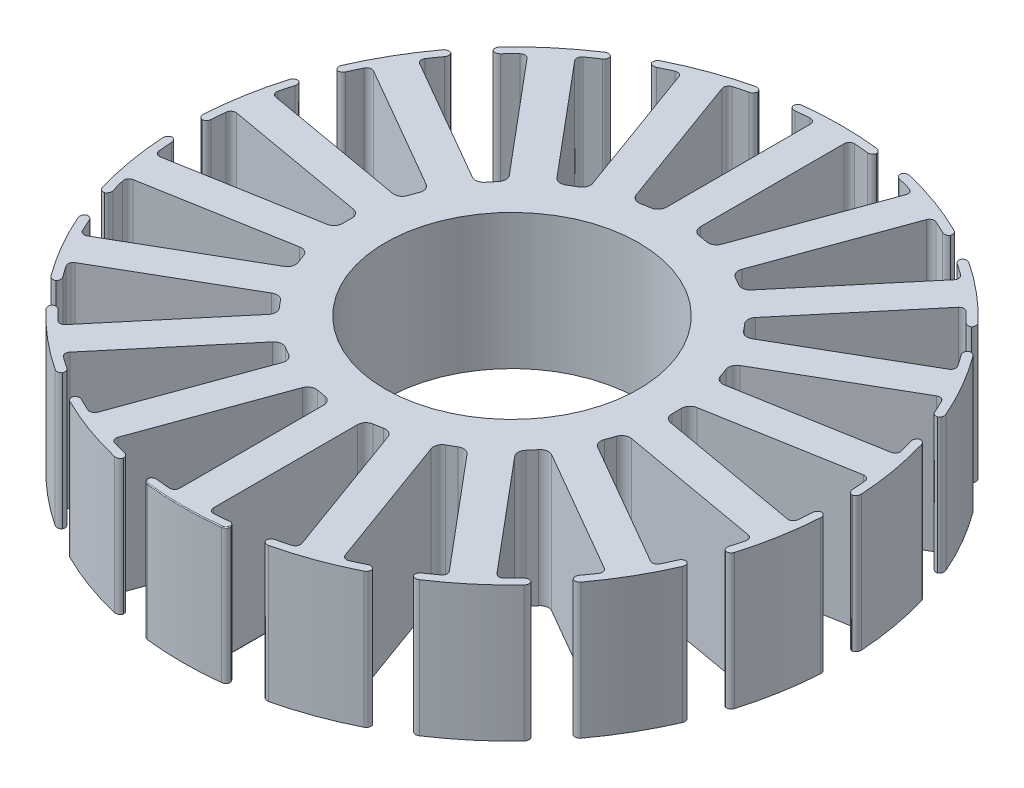
from build123d import *

# Parameters (mm, degrees)
SKETCH1_R           = 9.75
BOSS_EXTRUDE1_DEPTH = 4
BOSS_EXTRUDE2_DEPTH = 8
FILLET1_R           = 0.3
CIRPATTERN1_START   = -4
CIRPATTERN1_DEPTH   = 8
FILLET2_R           = 0.5
SKETCH3_R           = 7.5
CUT_EXTRUDE1_DEPTH  = 29.68939020627841
FILLET3_R           = 0.05


# Read off the part's stored shape, not the designer's step: CirPattern1
with BuildPart() as part:
    # Sketch1 → Boss-Extrude1 (new, symmetric)
    with BuildSketch(Plane(origin=(0, 0, 0), x_dir=(1, 0, 0), z_dir=(0, 1, 0))):
        with Locations(Location((0, 0, 0), (0, 0, 270))):
            Circle(SKETCH1_R)
    extrude(amount=BOSS_EXTRUDE1_DEPTH, both=True)

    # Sketch2 → Boss-Extrude2 (add)
    with BuildSketch(Plane(origin=(0, 4, 0), x_dir=(1, 0, 0), z_dir=(0, 1, 0))):
        with BuildLine():
            Line((-2.5, 19.339079605813716), (-2.4358974358974352, 18.84320576976721))
            ThreePointArc((-2.4358974358974352, 18.84320576976721), (-1.719186657369247, 18.92206112549908), (-1.0000000000000002, 18.973665961010276))
            Line((-1.0000000000000002, 18.973665961010276), (-1.0000000000000016, 9.69858237063541))
            ThreePointArc((-1.0000000000000016, 9.69858237063541), (6e-16, 9.749999999999998), (1.0000000000000016, 9.69858237063541))
            Line((1.0000000000000016, 9.69858237063541), (1.0000000000000002, 18.973665961010276))
            ThreePointArc((1.0000000000000002, 18.973665961010276), (1.719186657369245, 18.92206112549908), (2.4358974358974352, 18.84320576976721))
            Line((2.4358974358974352, 18.84320576976721), (2.5, 19.339079605813716))
            ThreePointArc((2.5, 19.339079605813716), (1.19e-15, 19.5), (-2.5, 19.339079605813716))
        make_face()
    extrude(amount=-BOSS_EXTRUDE2_DEPTH)

    # Fillet1
    # the kernel refuses this fillet: 0.3 mm, written as the material it adds along each edge
    with BuildSketch(Plane(origin=(-1.0000000000000004, 4, -18.973665961010276), x_dir=(7e-16, 0, 1), z_dir=(0, -1, 0))) as fillet1_piece_1:
        with BuildLine():
            CenterArc((0.3189078548326447, 0.30000000000000004), FILLET1_R, 176.01365563324396, 93.9863443667561)
            ThreePointArc((0.01963366061589134, 0.320855614973262), (0.00913825970817672, 0.16046933029077692), (0, 0))
            Line((0, 0), (0.31890785483264494, 0))
        make_face()
    extrude(amount=8)
    with BuildSketch(Plane(origin=(1.0000000000000002, 4, -18.973665961010276), x_dir=(0, 0, 1), z_dir=(0, -1, 0))) as fillet1_piece_2:
        with BuildLine():
            CenterArc((0.3189078548326485, -0.30000000000000004), FILLET1_R, 90, 93.98634436675627)
            ThreePointArc((0.01963366061589511, -0.3208556149732631), (0.00913825970818749, -0.16046933029077737), (0, 0))
            Line((0, 0), (0.3189078548326485, 0))
        make_face()
    extrude(amount=8)
    # the kernel refuses this fillet: 0.3 mm, written as the material it takes off along each edge
    with BuildSketch(Plane(origin=(2.5, 4.7617419982947435, -19.339079605813716), x_dir=(-0.12820512820513022, 0, 0.9917476720930107), z_dir=(0, -1, 0))) as fillet1_2_piece_1:
        with BuildLine():
            CenterArc((0.3023438930686183, 0.3000000000000001), FILLET1_R, 179.10471701342968, 90.89528298657052)
            ThreePointArc((0.00238051639781486, 0.3046875000000011), (0.00059513818123078, 0.15234839965894825), (0, 0))
            Line((0, 0), (0.30234389306861936, -1e-17))
        make_face()
    extrude(amount=9.523483996589487, mode=Mode.SUBTRACT)
    with BuildSketch(Plane(origin=(2.4358974358974352, 4.744170632315791, -18.84320576976721), x_dir=(-0.9927141599266197, 0, -0.12049313956066374), z_dir=(0, -1, 0))) as fillet1_2_piece_2:
        with BuildLine():
            CenterArc((0.29767738495924506, 0.2999909386698613), FILLET1_R, 180.44532191998718, 89.10935616002467)
            Line((-0.00231355371061729, 0.2976592620252788), (0, 0))
            ThreePointArc((0, 0), (0.14767285415732825, 0.00057388424205642), (0.29534570831465756, 0))
        make_face()
    extrude(amount=9.488341264631583, mode=Mode.SUBTRACT)
    with BuildSketch(Plane(origin=(-2.4999999999999996, 4.761741998294736, -19.339079605813712), x_dir=(0.992719037180409, 0, -0.1204529502320369), z_dir=(0, -1, 0))) as fillet1_2_piece_3:
        with BuildLine():
            CenterArc((0.3023529777846742, 0.29999084402798165), FILLET1_R, 179.55235850671582, 90.89528298657035)
            Line((0.00236213375669306, 0.30233466556119165), (0, 0))
            ThreePointArc((0, 0), (0.152348399658946, -0.00059513818123317), (0.30469679931789456, 0))
        make_face()
    extrude(amount=9.523483996589473, mode=Mode.SUBTRACT)
    with BuildSketch(Plane(origin=(-2.4358974358974357, 4.7441706323157815, -18.843205769767213), x_dir=(-0.1282051282051297, 0, -0.9917476720930108), z_dir=(0, -1, 0))) as fillet1_2_piece_4:
        with BuildLine():
            CenterArc((0.29766825292631033, 0.3000000000000001), FILLET1_R, 180.89064383997697, 89.1093561600228)
            ThreePointArc((-0.00229550230052261, 0.2953367875647671), (-0.00057388424205535, 0.14767285415733003), (0, 0))
            Line((0, 0), (0.29766825292630916, 0))
        make_face()
    extrude(amount=9.488341264631565, mode=Mode.SUBTRACT)

    # CirPattern1 outline → CirPattern1 (add)
    with BuildSketch(Plane(origin=(0, 0, 0), x_dir=(1, 0, 0), z_dir=(0, 1, 0)).offset(CIRPATTERN1_START)):
        with BuildLine():
            ThreePointArc((8.843866585, 17.095570796), (8.834578433, 17.303770723), (8.691902388, 17.455681965))
            ThreePointArc((8.691902388, 17.455681965), (6.669392795, 18.324006105), (4.561912562, 18.95887533))
            ThreePointArc((4.561912562, 18.95887533), (4.354969706, 18.934214961), (4.214026235, 18.780694873))
            ThreePointArc((4.214026235, 18.780694873), (4.273128601, 18.585426965), (4.443444721, 18.473110161))
            ThreePointArc((4.443444721, 18.473110161), (4.843596075, 18.37225019), (5.241462569, 18.262723514))
            ThreePointArc((5.241462569, 18.262723514), (5.42602082, 18.110530017), (5.44061042, 17.871758678))
            Line((5.44061042, 17.871758678), (2.377417912, 9.455706429))
            ThreePointArc((2.377417912, 9.455706429), (3.334696398, 9.162003053), (4.256803153, 8.771666143))
            Line((4.256803153, 8.771666143), (7.319995662, 17.187718392))
            ThreePointArc((7.319995662, 17.187718392), (7.484651202, 17.361249834), (7.723859118, 17.35920506))
            ThreePointArc((7.723859118, 17.35920506), (8.099044926, 17.18736371), (8.470410186, 17.007414597))
            ThreePointArc((8.470410186, 17.007414597), (8.673075754, 16.983977169), (8.843866585, 17.095570796))
        make_face()
        with BuildLine():
            Line((-7.319995662, 17.187718392), (-4.256803153, 8.771666143))
            ThreePointArc((-4.256803153, 8.771666143), (-3.334696398, 9.162003053), (-2.377417912, 9.455706429))
            Line((-2.377417912, 9.455706429), (-5.44061042, 17.871758678))
            ThreePointArc((-5.44061042, 17.871758678), (-5.42602082, 18.110530017), (-5.241462569, 18.262723514))
            ThreePointArc((-5.241462569, 18.262723514), (-4.843596075, 18.37225019), (-4.443444721, 18.473110161))
            ThreePointArc((-4.443444721, 18.473110161), (-4.273128601, 18.585426965), (-4.214026235, 18.780694873))
            ThreePointArc((-4.214026235, 18.780694873), (-4.354969706, 18.934214961), (-4.561912562, 18.95887533))
            ThreePointArc((-4.561912562, 18.95887533), (-6.669392795, 18.324006105), (-8.691902388, 17.455681965))
            ThreePointArc((-8.691902388, 17.455681965), (-8.834578433, 17.303770723), (-8.843866585, 17.095570796))
            ThreePointArc((-8.843866585, 17.095570796), (-8.673075754, 16.983977169), (-8.470410186, 17.007414597))
            ThreePointArc((-8.470410186, 17.007414597), (-8.099044926, 17.18736371), (-7.723859118, 17.35920506))
            ThreePointArc((-7.723859118, 17.35920506), (-7.484651202, 17.361249834), (-7.319995662, 17.187718392))
        make_face()
        with BuildLine():
            Line((-12.757091815, 13.647586175), (-7.000173023, 6.786757522))
            ThreePointArc((-7.000173023, 6.786757522), (-6.267179195, 7.468933321), (-5.468084136, 8.072332741))
            Line((-5.468084136, 8.072332741), (-11.225002929, 14.933161395))
            ThreePointArc((-11.225002929, 14.933161395), (-11.292957797, 15.162522997), (-11.171583012, 15.368660742))
            ThreePointArc((-11.171583012, 15.368660742), (-10.835171134, 15.607660507), (-10.493648, 15.8392977))
            ThreePointArc((-10.493648, 15.8392977), (-10.372017809, 16.003092517), (-10.383265309, 16.206798528))
            ThreePointArc((-10.383265309, 16.206798528), (-10.568215811, 16.302854716), (-10.771112829, 16.255249258))
            ThreePointArc((-10.771112829, 16.255249258), (-12.534358389, 14.937866641), (-14.137911382, 13.430169833))
            ThreePointArc((-14.137911382, 13.430169833), (-14.220026304, 13.238621878), (-14.157545743, 13.039801208))
            ThreePointArc((-14.157545743, 13.039801208), (-13.958887591, 12.993351405), (-13.776460325, 13.084691089))
            ThreePointArc((-13.776460325, 13.084691089), (-13.489037352, 13.380802342), (-13.19525122, 13.670601495))
            ThreePointArc((-13.19525122, 13.670601495), (-12.97116866, 13.75433688), (-12.757091815, 13.647586175))
        make_face()
        with BuildLine():
            Line((-16.655494421, 8.461353649), (-8.899218714, 3.983265782))
            ThreePointArc((-8.899218714, 3.983265782), (-8.443747687, 4.875), (-7.899218714, 5.715316589))
            Line((-7.899218714, 5.715316589), (-15.655494421, 10.193404457))
            ThreePointArc((-15.655494421, 10.193404457), (-15.797797397, 10.385691928), (-15.754245669, 10.620910667))
            ThreePointArc((-15.754245669, 10.620910667), (-15.519864643, 10.960556622), (-15.278162461, 11.295032174))
            ThreePointArc((-15.278162461, 11.295032174), (-15.219888594, 11.49054893), (-15.300129346, 11.678123094))
            ThreePointArc((-15.300129346, 11.678123094), (-15.506779119, 11.705129588), (-15.681157924, 11.591000223))
            ThreePointArc((-15.681157924, 11.591000223), (-16.887495374, 9.75), (-17.87867961, 7.784781011))
            ThreePointArc((-17.87867961, 7.784781011), (-17.890329137, 7.576699854), (-17.763615941, 7.411239148))
            ThreePointArc((-17.763615941, 7.411239148), (-17.561051574, 7.4355357), (-17.42086603, 7.583760727))
            ThreePointArc((-17.42086603, 7.583760727), (-17.252052796, 7.960318733), (-17.075101284, 8.333121633))
            ThreePointArc((-17.075101284, 8.333121633), (-16.893171744, 8.488447905), (-16.655494421, 8.461353649))
        make_face()
        with BuildLine():
            Line((-18.544998591, 2.254556997), (-9.72488729, 0.699333402))
            ThreePointArc((-9.72488729, 0.699333402), (-9.601875592, 1.693069733), (-9.377590934, 2.668948908))
            Line((-9.377590934, 2.668948908), (-18.197702236, 4.224172503))
            ThreePointArc((-18.197702236, 4.224172503), (-18.39718948, 4.356193137), (-18.43671379, 4.592122019))
            ThreePointArc((-18.43671379, 4.592122019), (-18.332633427, 4.991447848), (-18.219905047, 5.388419071))
            ThreePointArc((-18.219905047, 5.388419071), (-18.232016193, 5.59207556), (-18.371571978, 5.740893665))
            ThreePointArc((-18.371571978, 5.740893665), (-18.574996009, 5.695593082), (-18.699823944, 5.528705497))
            ThreePointArc((-18.699823944, 5.528705497), (-19.203751184, 3.386139465), (-19.463015216, 1.200432708))
            ThreePointArc((-19.463015216, 1.200432708), (-19.402794244, 1.000916007), (-19.227131894, 0.888772268))
            ThreePointArc((-19.227131894, 0.888772268), (-19.045093563, 0.980884652), (-18.964058187, 1.168116897))
            ThreePointArc((-18.964058187, 1.168116897), (-18.93421606, 1.579703203), (-18.895442131, 1.990544318))
            ThreePointArc((-18.895442131, 1.990544318), (-18.777608999, 2.198726837), (-18.544998591, 2.254556997))
        make_face()
        with BuildLine():
            Line((-18.197702236, -4.224172503), (-9.377590934, -2.668948908))
            ThreePointArc((-9.377590934, -2.668948908), (-9.601875592, -1.693069733), (-9.72488729, -0.699333402))
            Line((-9.72488729, -0.699333402), (-18.544998591, -2.254556997))
            ThreePointArc((-18.544998591, -2.254556997), (-18.777608999, -2.198726837), (-18.895442131, -1.990544318))
            ThreePointArc((-18.895442131, -1.990544318), (-18.93421606, -1.579703203), (-18.964058187, -1.168116897))
            ThreePointArc((-18.964058187, -1.168116897), (-19.045093563, -0.980884652), (-19.227131894, -0.888772268))
            ThreePointArc((-19.227131894, -0.888772268), (-19.402794244, -1.000916007), (-19.463015216, -1.200432708))
            ThreePointArc((-19.463015216, -1.200432708), (-19.203751184, -3.386139465), (-18.699823944, -5.528705497))
            ThreePointArc((-18.699823944, -5.528705497), (-18.574996009, -5.695593082), (-18.371571978, -5.740893665))
            ThreePointArc((-18.371571978, -5.740893665), (-18.232016193, -5.59207556), (-18.219905047, -5.388419071))
            ThreePointArc((-18.219905047, -5.388419071), (-18.332633427, -4.991447848), (-18.43671379, -4.592122019))
            ThreePointArc((-18.43671379, -4.592122019), (-18.39718948, -4.356193137), (-18.197702236, -4.224172503))
        make_face()
        with BuildLine():
            Line((-15.655494421, -10.193404457), (-7.899218714, -5.715316589))
            ThreePointArc((-7.899218714, -5.715316589), (-8.443747687, -4.875), (-8.899218714, -3.983265782))
            Line((-8.899218714, -3.983265782), (-16.655494421, -8.461353649))
            ThreePointArc((-16.655494421, -8.461353649), (-16.893171744, -8.488447905), (-17.075101284, -8.333121633))
            ThreePointArc((-17.075101284, -8.333121633), (-17.252052796, -7.960318733), (-17.42086603, -7.583760727))
            ThreePointArc((-17.42086603, -7.583760727), (-17.561051574, -7.4355357), (-17.763615941, -7.411239148))
            ThreePointArc((-17.763615941, -7.411239148), (-17.890329137, -7.576699854), (-17.87867961, -7.784781011))
            ThreePointArc((-17.87867961, -7.784781011), (-16.887495374, -9.75), (-15.681157924, -11.591000223))
            ThreePointArc((-15.681157924, -11.591000223), (-15.506779119, -11.705129588), (-15.300129346, -11.678123094))
            ThreePointArc((-15.300129346, -11.678123094), (-15.219888594, -11.49054893), (-15.278162461, -11.295032174))
            ThreePointArc((-15.278162461, -11.295032174), (-15.519864643, -10.960556622), (-15.754245669, -10.620910667))
            ThreePointArc((-15.754245669, -10.620910667), (-15.797797397, -10.385691928), (-15.655494421, -10.193404457))
        make_face()
        with BuildLine():
            Line((-11.225002929, -14.933161395), (-5.468084136, -8.072332741))
            ThreePointArc((-5.468084136, -8.072332741), (-6.267179194, -7.468933321), (-7.000173023, -6.786757522))
            Line((-7.000173023, -6.786757522), (-12.757091815, -13.647586175))
            ThreePointArc((-12.757091815, -13.647586175), (-12.97116866, -13.75433688), (-13.19525122, -13.670601495))
            ThreePointArc((-13.19525122, -13.670601495), (-13.489037352, -13.380802342), (-13.776460325, -13.084691089))
            ThreePointArc((-13.776460325, -13.084691089), (-13.958887591, -12.993351405), (-14.157545743, -13.039801208))
            ThreePointArc((-14.157545743, -13.039801208), (-14.220026304, -13.238621878), (-14.137911382, -13.430169833))
            ThreePointArc((-14.137911382, -13.430169833), (-12.534358389, -14.937866641), (-10.771112829, -16.255249258))
            ThreePointArc((-10.771112829, -16.255249258), (-10.568215811, -16.302854716), (-10.383265309, -16.206798528))
            ThreePointArc((-10.383265309, -16.206798528), (-10.372017809, -16.003092517), (-10.493648, -15.8392977))
            ThreePointArc((-10.493648, -15.8392977), (-10.835171134, -15.607660507), (-11.171583012, -15.368660742))
            ThreePointArc((-11.171583012, -15.368660742), (-11.292957797, -15.162522997), (-11.225002929, -14.933161395))
        make_face()
        with BuildLine():
            Line((-5.44061042, -17.871758678), (-2.377417912, -9.455706429))
            ThreePointArc((-2.377417912, -9.455706429), (-3.334696398, -9.162003053), (-4.256803153, -8.771666142))
            Line((-4.256803153, -8.771666142), (-7.319995662, -17.187718392))
            ThreePointArc((-7.319995662, -17.187718392), (-7.484651202, -17.361249834), (-7.723859118, -17.35920506))
            ThreePointArc((-7.723859118, -17.35920506), (-8.099044926, -17.18736371), (-8.470410186, -17.007414597))
            ThreePointArc((-8.470410186, -17.007414597), (-8.673075754, -16.983977169), (-8.843866585, -17.095570796))
            ThreePointArc((-8.843866585, -17.095570796), (-8.834578433, -17.303770723), (-8.691902388, -17.455681965))
            ThreePointArc((-8.691902388, -17.455681965), (-6.669392795, -18.324006105), (-4.561912562, -18.95887533))
            ThreePointArc((-4.561912562, -18.95887533), (-4.354969706, -18.934214961), (-4.214026235, -18.780694873))
            ThreePointArc((-4.214026235, -18.780694873), (-4.273128601, -18.585426965), (-4.443444721, -18.473110161))
            ThreePointArc((-4.443444721, -18.473110161), (-4.843596075, -18.37225019), (-5.241462569, -18.262723514))
            ThreePointArc((-5.241462569, -18.262723514), (-5.42602082, -18.110530017), (-5.44061042, -17.871758678))
        make_face()
        with BuildLine():
            Line((1, -18.654758106), (1, -9.698582371))
            ThreePointArc((1, -9.698582371), (0, -9.75), (-1, -9.698582371))
            Line((-1, -9.698582371), (-1, -18.654758106))
            ThreePointArc((-1, -18.654758106), (-1.095374347, -18.874139833), (-1.320855615, -18.9540323))
            ThreePointArc((-1.320855615, -18.9540323), (-1.732188153, -18.920875355), (-2.142703569, -18.878792901))
            ThreePointArc((-2.142703569, -18.878792901), (-2.34116298, -18.92608463), (-2.463486595, -19.089362242))
            ThreePointArc((-2.463486595, -19.089362242), (-2.383550018, -19.281829442), (-2.197521687, -19.375781234))
            ThreePointArc((-2.197521687, -19.375781234), (0, -19.5), (2.197521687, -19.375781234))
            ThreePointArc((2.197521687, -19.375781234), (2.383550018, -19.281829442), (2.463486595, -19.089362242))
            ThreePointArc((2.463486595, -19.089362242), (2.34116298, -18.92608463), (2.142703569, -18.878792901))
            ThreePointArc((2.142703569, -18.878792901), (1.732188153, -18.920875355), (1.320855615, -18.9540323))
            ThreePointArc((1.320855615, -18.9540323), (1.095374347, -18.874139833), (1, -18.654758106))
        make_face()
        with BuildLine():
            Line((7.319995662, -17.187718392), (4.256803153, -8.771666142))
            ThreePointArc((4.256803153, -8.771666142), (3.334696398, -9.162003053), (2.377417912, -9.455706429))
            Line((2.377417912, -9.455706429), (5.44061042, -17.871758678))
            ThreePointArc((5.44061042, -17.871758678), (5.42602082, -18.110530017), (5.241462569, -18.262723514))
            ThreePointArc((5.241462569, -18.262723514), (4.843596075, -18.37225019), (4.443444721, -18.473110161))
            ThreePointArc((4.443444721, -18.473110161), (4.273128601, -18.585426965), (4.214026235, -18.780694873))
            ThreePointArc((4.214026235, -18.780694873), (4.354969706, -18.934214961), (4.561912562, -18.95887533))
            ThreePointArc((4.561912562, -18.95887533), (6.669392795, -18.324006105), (8.691902388, -17.455681965))
            ThreePointArc((8.691902388, -17.455681965), (8.834578433, -17.303770723), (8.843866585, -17.095570796))
            ThreePointArc((8.843866585, -17.095570796), (8.673075754, -16.983977169), (8.470410186, -17.007414597))
            ThreePointArc((8.470410186, -17.007414597), (8.099044926, -17.18736371), (7.723859118, -17.35920506))
            ThreePointArc((7.723859118, -17.35920506), (7.484651202, -17.361249834), (7.319995662, -17.187718392))
        make_face()
        with BuildLine():
            Line((12.757091815, -13.647586175), (7.000173023, -6.786757522))
            ThreePointArc((7.000173023, -6.786757522), (6.267179194, -7.468933321), (5.468084136, -8.072332741))
            Line((5.468084136, -8.072332741), (11.225002929, -14.933161395))
            ThreePointArc((11.225002929, -14.933161395), (11.292957797, -15.162522997), (11.171583012, -15.368660742))
            ThreePointArc((11.171583012, -15.368660742), (10.835171134, -15.607660507), (10.493648, -15.8392977))
            ThreePointArc((10.493648, -15.8392977), (10.372017809, -16.003092517), (10.383265309, -16.206798528))
            ThreePointArc((10.383265309, -16.206798528), (10.568215811, -16.302854716), (10.771112829, -16.255249258))
            ThreePointArc((10.771112829, -16.255249258), (12.534358389, -14.937866641), (14.137911382, -13.430169833))
            ThreePointArc((14.137911382, -13.430169833), (14.220026304, -13.238621878), (14.157545743, -13.039801208))
            ThreePointArc((14.157545743, -13.039801208), (13.958887591, -12.993351405), (13.776460325, -13.084691089))
            ThreePointArc((13.776460325, -13.084691089), (13.489037352, -13.380802342), (13.19525122, -13.670601495))
            ThreePointArc((13.19525122, -13.670601495), (12.97116866, -13.75433688), (12.757091815, -13.647586175))
        make_face()
        with BuildLine():
            Line((16.655494421, -8.461353649), (8.899218714, -3.983265782))
            ThreePointArc((8.899218714, -3.983265782), (8.443747687, -4.875), (7.899218714, -5.715316589))
            Line((7.899218714, -5.715316589), (15.655494421, -10.193404457))
            ThreePointArc((15.655494421, -10.193404457), (15.797797397, -10.385691928), (15.754245669, -10.620910667))
            ThreePointArc((15.754245669, -10.620910667), (15.519864643, -10.960556622), (15.278162461, -11.295032174))
            ThreePointArc((15.278162461, -11.295032174), (15.219888594, -11.49054893), (15.300129346, -11.678123094))
            ThreePointArc((15.300129346, -11.678123094), (15.506779119, -11.705129588), (15.681157924, -11.591000223))
            ThreePointArc((15.681157924, -11.591000223), (16.887495374, -9.75), (17.87867961, -7.784781011))
            ThreePointArc((17.87867961, -7.784781011), (17.890329137, -7.576699854), (17.763615941, -7.411239148))
            ThreePointArc((17.763615941, -7.411239148), (17.561051574, -7.4355357), (17.42086603, -7.583760727))
            ThreePointArc((17.42086603, -7.583760727), (17.252052796, -7.960318733), (17.075101284, -8.333121633))
            ThreePointArc((17.075101284, -8.333121633), (16.893171744, -8.488447905), (16.655494421, -8.461353649))
        make_face()
        with BuildLine():
            Line((18.544998591, -2.254556997), (9.72488729, -0.699333402))
            ThreePointArc((9.72488729, -0.699333402), (9.601875592, -1.693069733), (9.377590934, -2.668948908))
            Line((9.377590934, -2.668948908), (18.197702236, -4.224172503))
            ThreePointArc((18.197702236, -4.224172503), (18.39718948, -4.356193137), (18.43671379, -4.592122019))
            ThreePointArc((18.43671379, -4.592122019), (18.332633427, -4.991447848), (18.219905047, -5.388419071))
            ThreePointArc((18.219905047, -5.388419071), (18.232016193, -5.59207556), (18.371571978, -5.740893665))
            ThreePointArc((18.371571978, -5.740893665), (18.574996009, -5.695593082), (18.699823944, -5.528705497))
            ThreePointArc((18.699823944, -5.528705497), (19.203751184, -3.386139465), (19.463015216, -1.200432708))
            ThreePointArc((19.463015216, -1.200432708), (19.402794244, -1.000916007), (19.227131894, -0.888772268))
            ThreePointArc((19.227131894, -0.888772268), (19.045093563, -0.980884652), (18.964058187, -1.168116897))
            ThreePointArc((18.964058187, -1.168116897), (18.93421606, -1.579703203), (18.895442131, -1.990544318))
            ThreePointArc((18.895442131, -1.990544318), (18.777608999, -2.198726837), (18.544998591, -2.254556997))
        make_face()
        with BuildLine():
            Line((18.197702236, 4.224172503), (9.377590934, 2.668948908))
            ThreePointArc((9.377590934, 2.668948908), (9.601875592, 1.693069733), (9.72488729, 0.699333402))
            Line((9.72488729, 0.699333402), (18.544998591, 2.254556997))
            ThreePointArc((18.544998591, 2.254556997), (18.777608999, 2.198726837), (18.895442131, 1.990544318))
            ThreePointArc((18.895442131, 1.990544318), (18.93421606, 1.579703203), (18.964058187, 1.168116897))
            ThreePointArc((18.964058187, 1.168116897), (19.045093563, 0.980884652), (19.227131894, 0.888772268))
            ThreePointArc((19.227131894, 0.888772268), (19.402794244, 1.000916007), (19.463015216, 1.200432708))
            ThreePointArc((19.463015216, 1.200432708), (19.203751184, 3.386139465), (18.699823944, 5.528705497))
            ThreePointArc((18.699823944, 5.528705497), (18.574996009, 5.695593082), (18.371571978, 5.740893665))
            ThreePointArc((18.371571978, 5.740893665), (18.232016193, 5.59207556), (18.219905047, 5.388419071))
            ThreePointArc((18.219905047, 5.388419071), (18.332633427, 4.991447848), (18.43671379, 4.592122019))
            ThreePointArc((18.43671379, 4.592122019), (18.39718948, 4.356193137), (18.197702236, 4.224172503))
        make_face()
        with BuildLine():
            Line((15.655494421, 10.193404457), (7.899218714, 5.715316589))
            ThreePointArc((7.899218714, 5.715316589), (8.443747687, 4.875), (8.899218714, 3.983265782))
            Line((8.899218714, 3.983265782), (16.655494421, 8.461353649))
            ThreePointArc((16.655494421, 8.461353649), (16.893171744, 8.488447905), (17.075101284, 8.333121633))
            ThreePointArc((17.075101284, 8.333121633), (17.252052796, 7.960318733), (17.42086603, 7.583760727))
            ThreePointArc((17.42086603, 7.583760727), (17.561051574, 7.4355357), (17.763615941, 7.411239148))
            ThreePointArc((17.763615941, 7.411239148), (17.890329137, 7.576699854), (17.87867961, 7.784781011))
            ThreePointArc((17.87867961, 7.784781011), (16.887495374, 9.75), (15.681157924, 11.591000223))
            ThreePointArc((15.681157924, 11.591000223), (15.506779119, 11.705129588), (15.300129346, 11.678123094))
            ThreePointArc((15.300129346, 11.678123094), (15.219888594, 11.49054893), (15.278162461, 11.295032174))
            ThreePointArc((15.278162461, 11.295032174), (15.519864643, 10.960556622), (15.754245669, 10.620910667))
            ThreePointArc((15.754245669, 10.620910667), (15.797797397, 10.385691928), (15.655494421, 10.193404457))
        make_face()
        with BuildLine():
            Line((11.225002929, 14.933161395), (5.468084136, 8.072332741))
            ThreePointArc((5.468084136, 8.072332741), (6.267179195, 7.468933321), (7.000173023, 6.786757522))
            Line((7.000173023, 6.786757522), (12.757091815, 13.647586175))
            ThreePointArc((12.757091815, 13.647586175), (12.97116866, 13.75433688), (13.19525122, 13.670601495))
            ThreePointArc((13.19525122, 13.670601495), (13.489037352, 13.380802342), (13.776460325, 13.084691089))
            ThreePointArc((13.776460325, 13.084691089), (13.958887591, 12.993351405), (14.157545743, 13.039801208))
            ThreePointArc((14.157545743, 13.039801208), (14.220026304, 13.238621878), (14.137911382, 13.430169833))
            ThreePointArc((14.137911382, 13.430169833), (12.534358389, 14.937866641), (10.771112829, 16.255249258))
            ThreePointArc((10.771112829, 16.255249258), (10.568215811, 16.302854716), (10.383265309, 16.206798528))
            ThreePointArc((10.383265309, 16.206798528), (10.372017809, 16.003092517), (10.493648, 15.8392977))
            ThreePointArc((10.493648, 15.8392977), (10.835171134, 15.607660507), (11.171583012, 15.368660742))
            ThreePointArc((11.171583012, 15.368660742), (11.292957797, 15.162522997), (11.225002929, 14.933161395))
        make_face()
    extrude(amount=CIRPATTERN1_DEPTH)

    # Fillet2
    fillet2_edges = [part.edges().sort_by_distance(p)[0] for p in [
        (9.724887290000002, 0, -0.6993334019999999),
        (9.377590934, 0, -2.6689489080000004),
        (9.377590934, 0, 2.668948908),
        (9.724887289999998, 0, 0.699333402),
        (7.899218714, 0, 5.715316589),
        (8.899218714, 0, 3.983265782),
        (5.468084136, 0, 8.072332741),
        (7.000173023, 0, 6.786757522),
        (2.377417912, 0, 9.455706429000001),
        (4.256803153, 0, 8.771666142),
        (-1.0000000000000002, 0, 9.698582371),
        (1, 0, 9.698582371),
        (-4.256803153, 0, 8.771666142),
        (-2.377417912, 0, 9.455706429),
        (-7.000173023, 0, 6.786757522),
        (-5.468084136, 0, 8.072332741),
        (-8.899218714, 0, 3.983265782),
        (-7.899218714, 0, 5.715316589),
        (-9.724887290000002, 0, 0.6993334019999999),
        (-9.377590934, 0, 2.6689489080000004),
        (-9.377590934, 0, -2.668948908),
        (-9.724887289999998, 0, -0.699333402),
        (-7.899218714, 0, -5.715316589),
        (-8.899218714, 0, -3.983265782),
        (-5.468084136, 0, -8.072332741000002),
        (-7.000173023, 0, -6.786757522),
        (-2.3774179119999994, 0, -9.455706429),
        (-4.256803153, 0, -8.771666143),
        (4.256803153, 0, -8.771666143000001),
        (2.377417912, 0, -9.455706429),
        (1.0000000000000018, 0, -9.69858237063541),
        (-1.0000000000000016, 0, -9.69858237063541),
        (7.000173023, 0, -6.786757522),
        (5.468084136, 0, -8.072332741),
        (8.899218714, 0, -3.983265782),
        (7.899218714, 0, -5.715316589),
    ]]
    fillet(fillet2_edges, radius=FILLET2_R)

    # Sketch3 → Cut-Extrude1 (cut, through all)
    with BuildSketch(Plane(origin=(0, 4, 0), x_dir=(1, 0, 0), z_dir=(0, 1, 0))):
        with Locations(Location((0, 0, 0), (0, 0, 270))):
            Circle(SKETCH3_R)
    extrude(amount=-CUT_EXTRUDE1_DEPTH, mode=Mode.SUBTRACT)

    # Fillet3
    fillet3_edges = [part.edges().sort_by_distance(p)[0] for p in [
        (5.426020820111072, -4, 18.110530016781944),
        (4.84359607496796, -4, 18.37225019000845),
        (2.3411629799137432, -4, 18.92608462994338),
        (1.0953743472458786, -4, 18.874139833229343),
        (1, -4, 14.397204000668314),
        (-2.3835500182295037, 4, 19.281829441752844),
        (3.9844411550030023, -4, 13.870966502648198),
        (0, 4, 19.500000000000004),
    ]]
    fillet(fillet3_edges, radius=FILLET3_R)


solid = part.part
